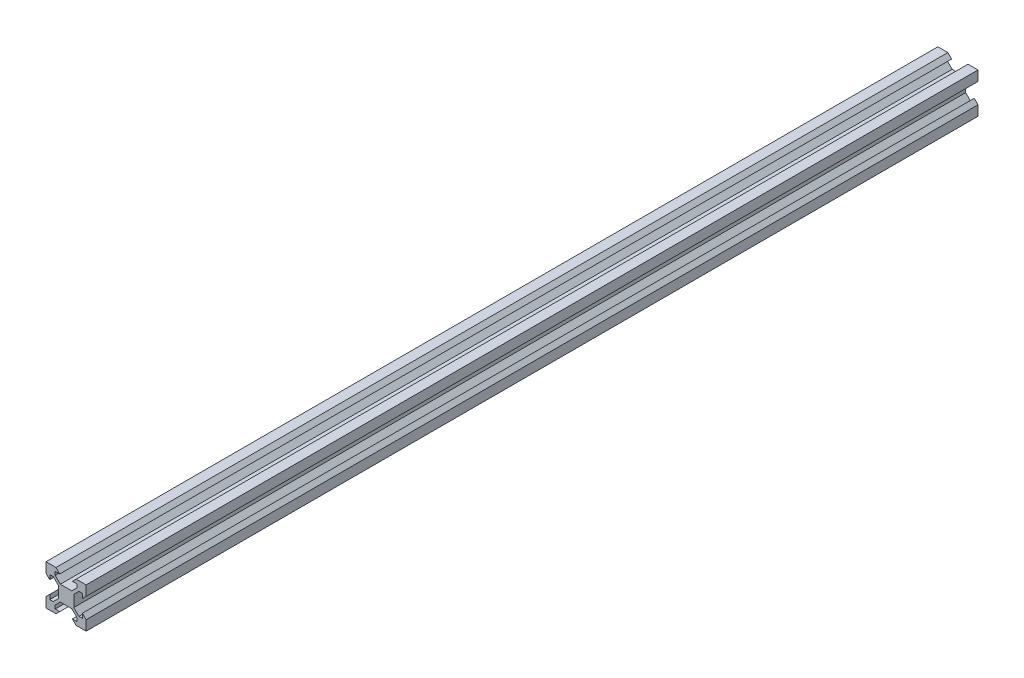
from build123d import *

# Parameters (mm, degrees)
BOSS_EXTRUDE1_DEPTH = 444.5


with BuildPart() as part:
    # Sketch1 → Boss-Extrude1 (new body)
    with BuildSketch(Plane.XY):
        Polygon((-2.860050506, 3.85), (2.860050506, 3.85), (5.4, 6.389949494), (5.4, 8.125), (3.15, 8.125), (5.025, 10), (10, 10), (10, 5.025), (8.125, 3.15), (8.125, 5.4), (6.389949494, 5.4), (3.85, 2.860050506), (3.85, -2.860050506), (6.389949494, -5.4), (8.125, -5.4), (8.125, -3.15), (10, -5.025), (10, -10), (5.025, -10), (3.15, -8.125), (5.4, -8.125), (5.4, -6.389949494), (2.860050506, -3.85), (-2.860050506, -3.85), (-5.4, -6.389949494), (-5.4, -8.125), (-3.15, -8.125), (-5.025, -10), (-10, -10), (-10, -5.025), (-8.125, -3.15), (-8.125, -5.4), (-6.389949494, -5.4), (-3.85, -2.860050506), (-3.85, 2.860050506), (-6.389949494, 5.4), (-8.125, 5.4), (-8.125, 3.15), (-10, 5.025), (-10, 10), (-5.025, 10), (-3.15, 8.125), (-5.4, 8.125), (-5.4, 6.389949494), align=None)
    extrude(amount=-BOSS_EXTRUDE1_DEPTH)


solid = part.part
